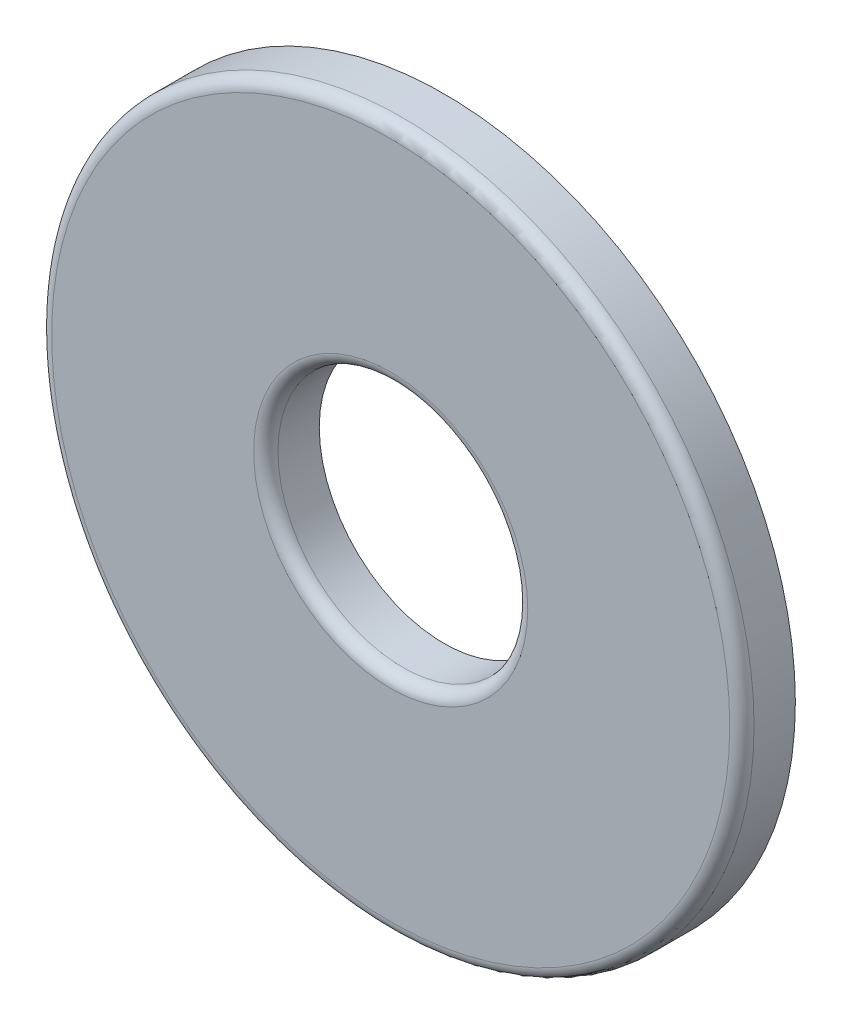
from build123d import *

# Parameters (mm, degrees)
SKETCH1_R           = 18.3515
SKETCH1_R_2         = 6.5278
BOSS_EXTRUDE1_DEPTH = 2.794
FILLET1_R           = 0.635


with BuildPart() as part:
    # Sketch1 → Boss-Extrude1 (new body)
    with BuildSketch(Plane(origin=(0, 0, 0), x_dir=(0, 1, 0), z_dir=(0, 0, 1))):
        Circle(SKETCH1_R)
        Circle(SKETCH1_R_2, mode=Mode.SUBTRACT)
    extrude(amount=BOSS_EXTRUDE1_DEPTH)

    # Fillet1
    fillet1_edges = [part.edges().sort_by_distance(p)[0] for p in [
        (0, -6.5278, 2.794),
        (0, -18.3515, 2.794),
    ]]
    fillet(fillet1_edges, radius=FILLET1_R)


solid = part.part
